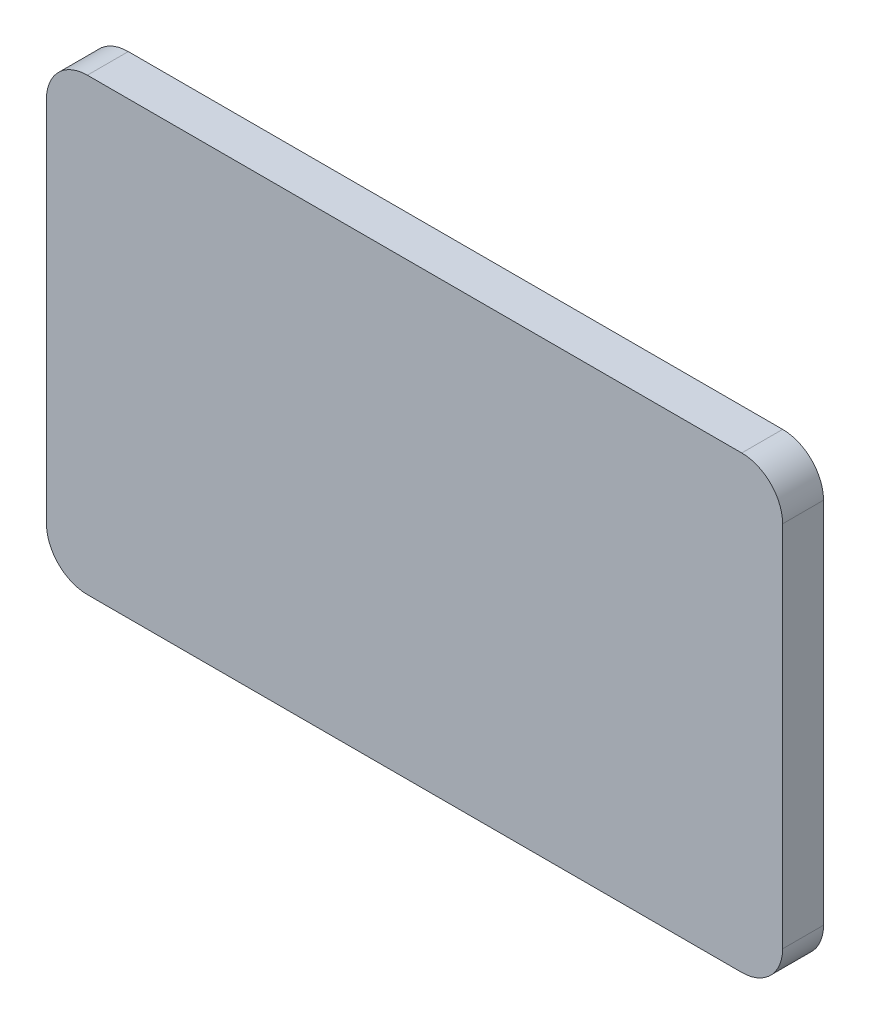
from build123d import *

# Parameters (mm, degrees)
SKETCH1_W           = 45.72
SKETCH1_H           = 27.94
BOSS_EXTRUDE1_DEPTH = 1.27
FILLET1_R           = 2.54


with BuildPart() as part:
    # Sketch1 → Boss-Extrude1 (new, symmetric)
    with BuildSketch(Plane.XY):
        Rectangle(SKETCH1_W, SKETCH1_H)
    extrude(amount=BOSS_EXTRUDE1_DEPTH, both=True)

    # Fillet1
    fillet1_edges = [part.edges().sort_by_distance(p)[0] for p in [
        (22.86, 13.97, 0),
        (22.86, -13.97, 0),
        (-22.86, -13.97, 0),
        (-22.86, 13.97, 0),
    ]]
    fillet(fillet1_edges, radius=FILLET1_R)


solid = part.part
